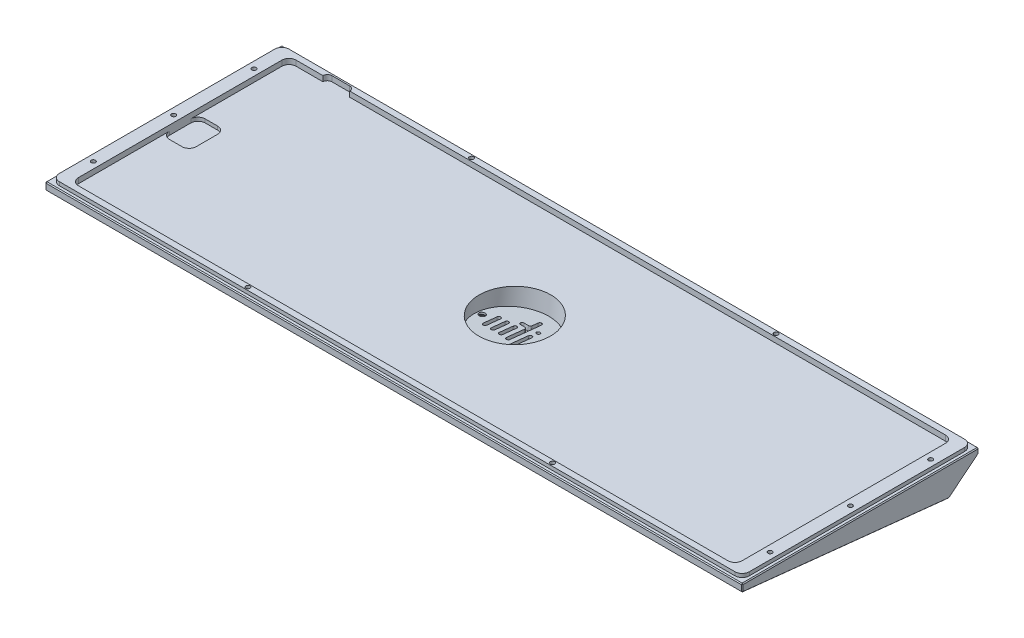
from build123d import *
from OCP.BRepFilletAPI import BRepFilletAPI_MakeChamfer

# Parameters (mm, degrees)
SKETCH1_W                                            = 390.7
SKETCH1_H                                            = 132.7
MAINBODY_DEPTH                                       = 18.5
SKETCH2_W                                            = 390.7
SKETCH2_H                                            = 132.7
SKETCH2_W_2                                          = 386.7
SKETCH2_H_2                                          = 128.7
ALIGMENTLIP_DEPTH                                    = 2
TYPINGANGLE_DEPTH                                    = 414.035143783
SKETCH4_W                                            = 372
SKETCH4_H                                            = 122
PCBCUTOUT_DEPTH                                      = 3
M2_CLEARANCE_HOLE2_D                                 = 2.4
CUT_EXTRUDE2_START                                   = -1
SKETCH11_R                                           = 2.5
CUT_EXTRUDE2_DEPTH                                   = 412.911649145
SKETCH12_W                                           = 15
SKETCH12_H                                           = 2.5
CUT_EXTRUDE3_DEPTH                                   = 3
FILLET1_R                                            = 2.5
SKETCH13_W                                           = 15
SKETCH13_H                                           = 20
CUT_EXTRUDE4_DEPTH                                   = 2
FILLET2_R                                            = 4
CUT_EXTRUDE7_START                                   = -11.833363055
CUT_EXTRUDE7_OUTLINE_W                               = 2
CUT_EXTRUDE7_OUTLINE_H                               = 17.5
CUT_EXTRUDE7_OUTLINE_H_2                             = 7.5
CUT_EXTRUDE7_OUTLINE_H_3                             = 10
CUT_EXTRUDE7_OUTLINE_R                               = 1
CUT_EXTRUDE7_DEPTH                                   = 11.833363055
FILLET3_R                                            = 1
CHAMFER1_SIZE                                        = 0.5
CHAMFER1_SIZE2                                       = 0.561801899
CUT_EXTRUDE10_START                                  = -2.5
SKETCH18_R                                           = 20
SKETCH18_W                                           = 25
SKETCH18_H                                           = 28
CUT_EXTRUDE10_DEPTH                                  = 410.891093571
FILLET4_R                                            = 1
CSK_FOR_M3_FLAT_HEAD_MACHINE_SCREW1_D                = 3.4
CSK_FOR_M3_FLAT_HEAD_MACHINE_SCREW1_CSINK_D          = 6.37874
CSK_FOR_M3_FLAT_HEAD_MACHINE_SCREW1_CSINK_ANGLE      = 90
CSK_FOR_M3_FLAT_HEAD_MACHINE_SCREW1_ON_F_D           = 3.4
CSK_FOR_M3_FLAT_HEAD_MACHINE_SCREW1_ON_F_CSINK_D     = 6.37874
CSK_FOR_M3_FLAT_HEAD_MACHINE_SCREW1_ON_F_CSINK_ANGLE = 90


# Read off the part's stored shape, not the designer's step: Cut-Extrude7
with BuildPart() as part:
    # Sketch1 → MainBody (new body)
    with BuildSketch(Plane(origin=(0, 0, 0), x_dir=(1, 0, 0), z_dir=(0, 1, 0))):
        with Locations((195.35, 66.35)):
            Rectangle(SKETCH1_W, SKETCH1_H)
    extrude(amount=MAINBODY_DEPTH)

    # Sketch2 → AligmentLip (cut)
    with BuildSketch(Plane(origin=(0, 18.5, 0), x_dir=(1, 0, 0), z_dir=(0, 1, 0))):
        with Locations((195.35, 66.35)):
            Rectangle(SKETCH2_W, SKETCH2_H)
        with Locations((195.35, 66.35)):
            Rectangle(SKETCH2_W_2, SKETCH2_H_2, mode=Mode.SUBTRACT)
    extrude(amount=-ALIGMENTLIP_DEPTH, mode=Mode.SUBTRACT)

    # Sketch3 → TypingAngle (cut, through all)
    with BuildSketch(Plane.ZY):
        Polygon((-116.028888387, 0), (-132.7, 13.5), (-132.7, 0), align=None)
        Polygon((0, 12.195127583), (-116.028888387, 0), (0, 0), align=None)
    extrude(amount=-TYPINGANGLE_DEPTH, mode=Mode.SUBTRACT)

    # Sketch4 → PCBCutout (cut)
    with BuildSketch(Plane(origin=(0, 18.5, 0), x_dir=(1, 0, 0), z_dir=(0, 1, 0))):
        with Locations((195.35, 66.35)):
            Rectangle(SKETCH4_W, SKETCH4_H)
    extrude(amount=-PCBCUTOUT_DEPTH, mode=Mode.SUBTRACT)

    # M2 Clearance Hole2 (through all)
    with Locations(Plane(origin=(110, 18.5, -129), x_dir=(0, 0, 1), z_dir=(0, 1, 0))):
        with Locations((0, 0), (17.65, -104.3), (62.65, -104.3), (107.65, -104.3), (125.3, 0), (0, 170.7), (125.3, 170.7), (107.65, 275), (62.65, 275), (17.65, 275)):
            Hole(M2_CLEARANCE_HOLE2_D / 2)

    # Sketch11 → Cut-Extrude2 (cut, through all)
    with BuildSketch(Plane(origin=(0, 15.5, 0), x_dir=(1, 0, 0), z_dir=(0, 1, 0)).offset(CUT_EXTRUDE2_START)):
        with Locations(Location((110, 129, 0), (0, 0, 270))):
            Circle(SKETCH11_R)
        with Locations(Location((5.7, 111.35, 0), (0, 0, 270))):
            Circle(SKETCH11_R)
        with Locations(Location((5.7, 66.35, 0), (0, 0, 270))):
            Circle(SKETCH11_R)
        with Locations(Location((5.7, 21.35, 0), (0, 0, 270))):
            Circle(SKETCH11_R)
        with Locations(Location((110, 3.7, 0), (0, 0, 270))):
            Circle(SKETCH11_R)
        with Locations(Location((280.7, 3.7, 0), (0, 0, 270))):
            Circle(SKETCH11_R)
        with Locations(Location((385, 21.35, 0), (0, 0, 270))):
            Circle(SKETCH11_R)
        with Locations(Location((385, 66.35, 0), (0, 0, 270))):
            Circle(SKETCH11_R)
        with Locations(Location((385, 111.35, 0), (0, 0, 270))):
            Circle(SKETCH11_R)
        with Locations(Location((280.7, 129, 0), (0, 0, 90))):
            Circle(SKETCH11_R)
    extrude(amount=-CUT_EXTRUDE2_DEPTH, mode=Mode.SUBTRACT)

    # Sketch12 → Cut-Extrude3 (cut)
    with BuildSketch(Plane(origin=(0, 18.5, 0), x_dir=(1, 0, 0), z_dir=(0, 1, 0))):
        with Locations((35.9, 128.6)):
            Rectangle(SKETCH12_W, SKETCH12_H)
    extrude(amount=-CUT_EXTRUDE3_DEPTH, mode=Mode.SUBTRACT)

    # Fillet1
    fillet1_edges = [part.edges().sort_by_distance(p)[0] for p in [
        (43.4, 17, -129.85),
        (28.4, 17, -129.85),
    ]]
    fillet(fillet1_edges, radius=FILLET1_R - 0.0001)  # a hair under: the kernel refuses the full size

    # Sketch13 → Cut-Extrude4 (cut)
    with BuildSketch(Plane(origin=(0, 15.5, 0), x_dir=(1, 0, 0), z_dir=(0, 1, 0))):
        with Locations((16.85, 66.35)):
            Rectangle(SKETCH13_W, SKETCH13_H)
    extrude(amount=-CUT_EXTRUDE4_DEPTH, mode=Mode.SUBTRACT)

    # Fillet2
    fillet2_edges = [part.edges().sort_by_distance(p)[0] for p in [
        (388.7, 17.5, -130.7),
        (2, 17.5, -130.7),
        (2, 17.5, -2),
        (388.7, 17.5, -2),
        (9.35, 14.5, -56.35),
        (9.35, 14.5, -76.35),
        (24.35, 14.5, -76.35),
        (24.35, 14.5, -56.35),
        (9.35, 17, -5.35),
        (9.35, 17, -127.35),
        (381.35, 17, -127.35),
        (381.35, 17, -5.35),
    ]]
    fillet(fillet2_edges, radius=FILLET2_R)

    # Cut-Extrude7 outline → Cut-Extrude7 (cut)
    with BuildSketch(Plane(origin=(0, 12.061881184, -1.267754798), x_dir=(1, 0, 0), z_dir=(0, -0.9945218953682734, 0.10452846326765429)).offset(CUT_EXTRUDE7_START)):
        with Locations((202.1, -60.945229197)):
            Rectangle(CUT_EXTRUDE7_OUTLINE_W, CUT_EXTRUDE7_OUTLINE_H)
        with BuildLine():
            Line((196.6, -79.695229197), (198.6, -79.695229197))
            Line((198.6, -79.695229197), (198.6, -59.695229197))
            Line((198.6, -59.695229197), (196.6, -59.695229197))
            Line((196.6, -59.695229197), (196.6, -72.204912456))
            Line((196.6, -72.204912456), (193.1, -72.21107453))
            ThreePointArc((193.1, -72.21107453), (192.115845333, -73.195229197), (193.1, -74.179383864))
            Line((193.1, -74.179383864), (196.6, -74.185545938))
            Line((196.6, -74.185545938), (196.6, -79.695229197))
        make_face()
        with Locations((207.1, -55.445229197)):
            Rectangle(CUT_EXTRUDE7_OUTLINE_W, CUT_EXTRUDE7_OUTLINE_H_2)
        with Locations((184.1, -65.195229197)):
            Rectangle(CUT_EXTRUDE7_OUTLINE_W, CUT_EXTRUDE7_OUTLINE_H_3)
        with Locations((188.6, -65.195229197)):
            Rectangle(CUT_EXTRUDE7_OUTLINE_W, CUT_EXTRUDE7_OUTLINE_H_3)
        with Locations((193.1, -65.195229197)):
            Rectangle(CUT_EXTRUDE7_OUTLINE_W, CUT_EXTRUDE7_OUTLINE_H_3)
        with Locations((202.1, -73.195229197)):
            Circle(CUT_EXTRUDE7_OUTLINE_R)
    extrude(amount=CUT_EXTRUDE7_DEPTH, mode=Mode.SUBTRACT)

    # Fillet3
    fillet3_edges = [part.edges().sort_by_distance(p)[0] for p in [
        (183.1, 10.63488319, -61.644572613),
        (187.6, 10.63488319, -61.644572613),
        (192.1, 10.63488319, -61.644572613),
        (185.1, 10.63488319, -61.644572613),
        (189.6, 10.63488319, -61.644572613),
        (194.1, 10.63488319, -61.644572613),
        (185.1, 10.112240874, -71.644723487),
        (189.6, 10.112240874, -71.644723487),
        (194.1, 10.112240874, -71.644723487),
        (183.1, 10.112240874, -71.644723487),
        (187.6, 10.112240874, -71.644723487),
        (192.1, 10.112240874, -71.644723487),
        (196.6, 9.615730673, -81.144866818),
        (198.6, 9.615730673, -81.144866818),
        (196.6, 10.661015306, -61.144565069),
        (198.6, 10.661015306, -61.144565069),
        (201.1, 11.052997043, -53.644451913),
        (203.1, 11.052997043, -53.644451913),
        (206.1, 11.079129159, -53.144444369),
        (208.1, 11.079129159, -53.144444369),
        (208.1, 10.687147422, -60.644557525),
        (206.1, 10.687147422, -60.644557525),
        (201.1, 10.13837299, -71.144715944),
        (203.1, 10.13837299, -71.144715944),
    ]]
    fillet(fillet3_edges, radius=FILLET3_R - 0.0001)  # a hair under: the kernel refuses the full size

    # Chamfer1: one chamfer whose edges measure the first distance from different faces: ONE call of the kernel's chamfer builder (chamfer() names one face for all edges)
    chamfer1_edges_1 = [part.edges().sort_by_distance(p)[0] for p in [
        (0, 15, -132.7),
        (390.7, 15, -132.7),
        (390.7, 14.347563791, 0),
        (0, 14.347563791, 0),
        (195.35, 16.5, -132.7),
        (390.7, 16.5, -66.35),
        (195.35, 16.5, 0),
        (0, 16.5, -66.35),
        (0, 6.75, -124.364444193),
        (390.7, 6.75, -124.364444193),
        (0, 6.097563791, -58.014444193),
        (390.7, 6.097563791, -58.014444193),
    ]]
    chamfer1_edges_2 = [part.edges().sort_by_distance(p)[0] for p in [
        (195.35, 12.195127583, 0),
    ]]
    chamfer1_side_2 = [part.faces().sort_by_distance(p)[0] for p in [
        (195.35, 14.347563791, 0),
    ]]
    chamfer1 = BRepFilletAPI_MakeChamfer(part.part.solid().wrapped)
    for e in chamfer1_edges_1:
        chamfer1.Add(CHAMFER1_SIZE, e.wrapped)
    for e in chamfer1_edges_2:
        chamfer1.Add(CHAMFER1_SIZE, CHAMFER1_SIZE2, e.wrapped, chamfer1_side_2[0].wrapped)  # the first distance lies on this face
    add(Compound.cast(chamfer1.Shape()), mode=Mode.REPLACE)

    # Sketch18 → Cut-Extrude10 (cut, through all)
    # profile 1 of 3: a face of its own
    with BuildSketch(Plane(origin=(0, 12.061881184, -1.267754798), x_dir=(1, 0, 0), z_dir=(0, -0.9945218953682734, 0.10452846326765429)).offset(CUT_EXTRUDE10_START)):
        with Locations(Location((195.6, -65.695229197, 0), (0, 0, 270))):
            Circle(SKETCH18_R)
        with Locations((195.6, -65.695229197)):
            Rectangle(SKETCH18_W, SKETCH18_H, mode=Mode.SUBTRACT)
    # profile 2 of 3: a face of its own
    with BuildSketch(Plane(origin=(0, 12.061881184, -1.267754798), x_dir=(1, 0, 0), z_dir=(0, -0.9945218953682734, 0.10452846326765429)).offset(CUT_EXTRUDE10_START)):
        Polygon((183.1, -51.695229197), (208.1, -79.695229197), (183.1, -79.695229197), align=None)
    # profile 3 of 3: a face of its own
    with BuildSketch(Plane(origin=(0, 12.061881184, -1.267754798), x_dir=(1, 0, 0), z_dir=(0, -0.9945218953682734, 0.10452846326765429)).offset(CUT_EXTRUDE10_START)):
        Polygon((208.1, -51.695229197), (183.1, -51.695229197), (208.1, -79.695229197), align=None)
    extrude(amount=-CUT_EXTRUDE10_DEPTH, mode=Mode.SUBTRACT)

    # Fillet4
    fillet4_edges = [part.edges().sort_by_distance(p)[0] for p in [
        (196.6, 5.757565014, -73.207781767),
        (196.6, 5.55053244, -75.177565132),
    ]]
    fillet(fillet4_edges, radius=FILLET4_R)

    # CSK for M3 Flat Head Machine Screw1 (through all)
    with Locations(Plane(origin=(213.1, 5.194859832, -66.603098655), x_dir=(0, -0.104528463268, -0.994521895368), z_dir=(0, -0.994521895368, 0.104528463268))):
        with Locations((0, 0)):
            CounterSinkHole(CSK_FOR_M3_FLAT_HEAD_MACHINE_SCREW1_D / 2, CSK_FOR_M3_FLAT_HEAD_MACHINE_SCREW1_CSINK_D / 2, counter_sink_angle=CSK_FOR_M3_FLAT_HEAD_MACHINE_SCREW1_CSINK_ANGLE)

    # CSK for M3 Flat Head Machine Screw1 on f (through all)
    with Locations(Plane(origin=(178.1, 5.194859832, -66.603098655), x_dir=(0, -0.104527994185, -0.994521944671), z_dir=(0, -0.994521944671, 0.104527994185))):
        with Locations((0, 0)):
            CounterSinkHole(CSK_FOR_M3_FLAT_HEAD_MACHINE_SCREW1_ON_F_D / 2, CSK_FOR_M3_FLAT_HEAD_MACHINE_SCREW1_ON_F_CSINK_D / 2, counter_sink_angle=CSK_FOR_M3_FLAT_HEAD_MACHINE_SCREW1_ON_F_CSINK_ANGLE)


solid = part.part
